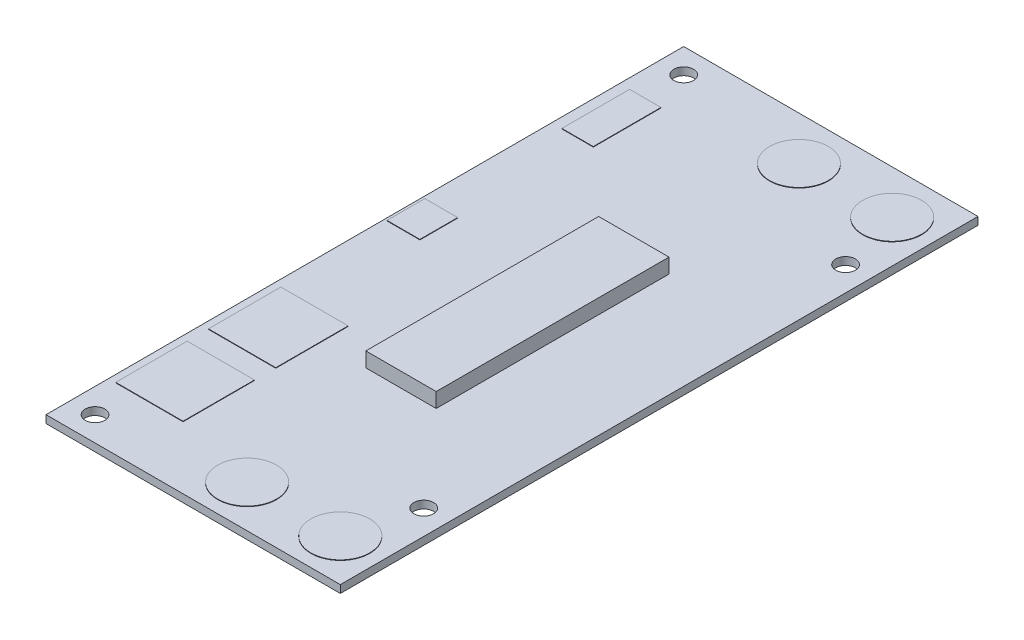
from build123d import *

# Parameters (mm, degrees)
SKETCH1_W               = 60
SKETCH1_H               = 130
BOSS_EXTRUDE1_DEPTH     = 1.57
SKETCH2_W               = 14.34441586
SKETCH2_H               = 47.463140714
BOSS_EXTRUDE2_DEPTH     = 3
BOSS_EXTRUDE6_START     = -1.57
BOSS_EXTRUDE6_OUTLINE_R = 2
BOSS_EXTRUDE6_DEPTH     = 1.57
SKETCH4_R               = 6
BOSS_EXTRUDE7_DEPTH     = 0.1
SKETCH5_W               = 13.72
SKETCH5_H               = 14.56
SKETCH5_H_2             = 14.76
BOSS_EXTRUDE8_DEPTH     = 0.1
SKETCH6_W               = 6.4
SKETCH6_H               = 13.8
BOSS_EXTRUDE9_DEPTH     = 0.1
SKETCH7_W               = 6.7
SKETCH7_H               = 7.7
BOSS_EXTRUDE10_DEPTH    = 0.1


# Read off the part's stored shape, not the designer's step: Boss-Extrude6
with BuildPart() as part:
    # Sketch1 → Boss-Extrude1 (new body)
    with BuildSketch(Plane(origin=(0, 0, 0), x_dir=(1, 0, 0), z_dir=(0, 1, 0))):
        with Locations((30, 65)):
            Rectangle(SKETCH1_W, SKETCH1_H)
    extrude(amount=BOSS_EXTRUDE1_DEPTH)

    # Sketch2 → Boss-Extrude2 (add)
    with BuildSketch(Plane(origin=(0, 1.57, 0), x_dir=(-1, 0, 0), z_dir=(0, 1, 0))):
        with Locations((-31.510634486, -64.593919343)):
            Rectangle(SKETCH2_W, SKETCH2_H)
    extrude(amount=BOSS_EXTRUDE2_DEPTH)

    # Boss-Extrude6 outline → Boss-Extrude6 (cut)
    with BuildSketch(Plane(origin=(0, 1.57, 0), x_dir=(-1, 0, 0), z_dir=(0, 1, 0)).offset(BOSS_EXTRUDE6_START)):
        with Locations((-5, -5)):
            Circle(BOSS_EXTRUDE6_OUTLINE_R)
        with Locations((-55, -22)):
            Circle(BOSS_EXTRUDE6_OUTLINE_R)
        with Locations((-5, -125)):
            Circle(BOSS_EXTRUDE6_OUTLINE_R)
        with Locations((-55, -108)):
            Circle(BOSS_EXTRUDE6_OUTLINE_R)
    extrude(amount=BOSS_EXTRUDE6_DEPTH, mode=Mode.SUBTRACT)

    # Sketch4 → Boss-Extrude7 (add)
    with BuildSketch(Plane(origin=(0, 1.57, 0), x_dir=(-1, 0, 0), z_dir=(0, 1, 0))):
        with Locations(Location((-32.5, -8.5, 0), (0, 0, 270))):
            Circle(SKETCH4_R)
        with Locations(Location((-51.5, -8.5, 0), (0, 0, 270))):
            Circle(SKETCH4_R)
        with Locations(Location((-32.5, -121, 0), (0, 0, 270))):
            Circle(SKETCH4_R)
        with Locations(Location((-51.5, -121, 0), (0, 0, 270))):
            Circle(SKETCH4_R)
    extrude(amount=BOSS_EXTRUDE7_DEPTH)

    # Sketch5 → Boss-Extrude8 (add)
    with BuildSketch(Plane(origin=(0, 1.57, 0), x_dir=(-1, 0, 0), z_dir=(0, 1, 0))):
        with Locations((-8.36, -20)):
            Rectangle(SKETCH5_W, SKETCH5_H)
        with Locations((-8.36, -39)):
            Rectangle(SKETCH5_W, SKETCH5_H_2)
    extrude(amount=BOSS_EXTRUDE8_DEPTH)

    # Sketch6 → Boss-Extrude9 (add)
    with BuildSketch(Plane(origin=(2.04497346, 1.57, -23.026190138), x_dir=(-1, 0, 0), z_dir=(0, 1, 0))):
        with Locations((-3.3, -86.9)):
            Rectangle(SKETCH6_W, SKETCH6_H)
    extrude(amount=BOSS_EXTRUDE9_DEPTH)

    # Sketch7 → Boss-Extrude10 (add)
    with BuildSketch(Plane(origin=(0.458943498, 1.57, 31.036587212), x_dir=(-1, 0, 0), z_dir=(0, 1, 0))):
        with Locations((-3.45, -103.85)):
            Rectangle(SKETCH7_W, SKETCH7_H)
    extrude(amount=BOSS_EXTRUDE10_DEPTH)


solid = part.part
